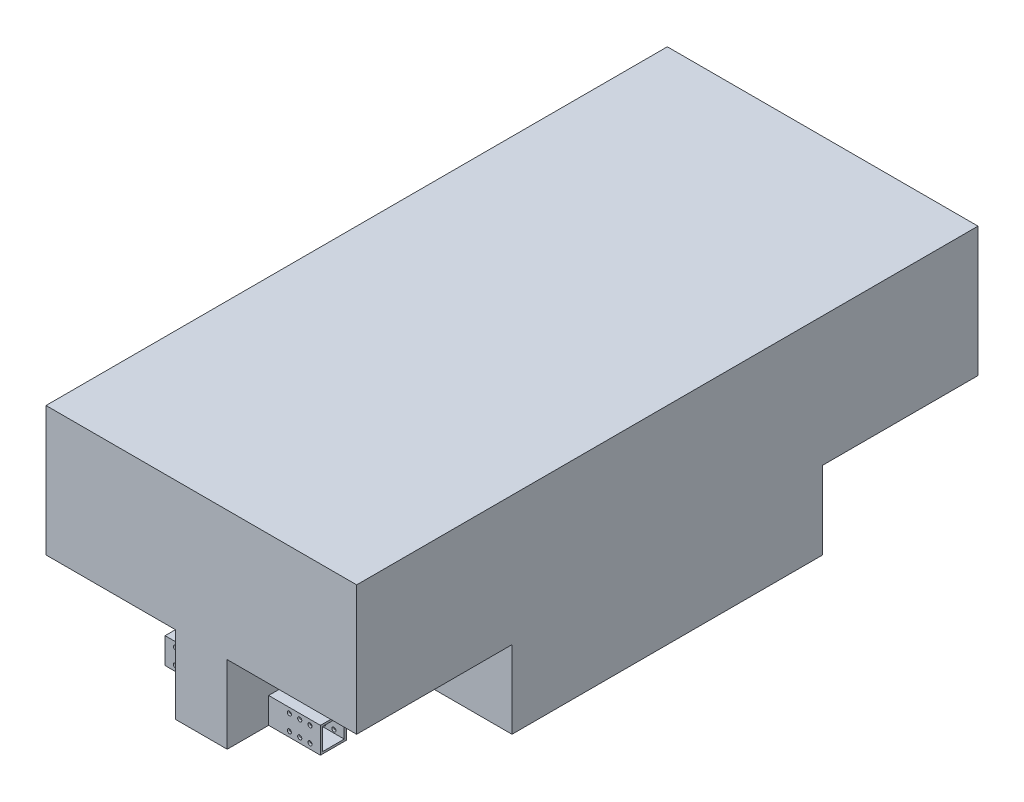
from build123d import *

# Parameters (mm, degrees)
BOSS_EXTRUDE1_DEPTH       = 150
BOSS_EXTRUDE1_DEPTH_BACK  = 150
SKETCH2_W                 = 600
SKETCH2_H                 = 200
SKETCH3_W                 = 150
SKETCH3_H                 = 75
CUT_EXTRUDE1_DEPTH        = 125
SKETCH4_W                 = 25
SKETCH4_H                 = 25
SKETCH4_W_2               = 21
SKETCH4_H_2               = 21
BOSS_EXTRUDE2_DEPTH       = 50
SKETCH5_R                 = 2
CUT_EXTRUDE2_DEPTH        = 25
MIRROR3_COPY_1_SKETCH_W   = 25
MIRROR3_COPY_1_SKETCH_H   = 25
MIRROR3_COPY_1_SKETCH_W_2 = 21
MIRROR3_COPY_1_SKETCH_H_2 = 21
MIRROR3_COPY_1_DEPTH      = 50
MIRROR3_COPY_2_SKETCH_R   = 2
MIRROR3_COPY_2_DEPTH      = 25
MIRROR3_COPY_3_SKETCH_W   = 25
MIRROR3_COPY_3_SKETCH_H   = 25
MIRROR3_COPY_3_SKETCH_W_2 = 21
MIRROR3_COPY_3_SKETCH_H_2 = 21
MIRROR3_COPY_3_DEPTH      = 50
MIRROR3_COPY_4_SKETCH_R   = 2
MIRROR3_COPY_4_DEPTH      = 25


with BuildPart() as part:
    # Sketch2 → Boss-Extrude1 (new, two sides: drawn at the far end of the back side and taken through both)
    with BuildSketch(Plane(origin=(0, 0, 0), x_dir=(0, 0, -1), z_dir=(1, 0, 0)).offset(-BOSS_EXTRUDE1_DEPTH_BACK)):
        Rectangle(SKETCH2_W, SKETCH2_H)
    extrude(amount=BOSS_EXTRUDE1_DEPTH + BOSS_EXTRUDE1_DEPTH_BACK)

    # Sketch3 → Cut-Extrude1 (cut)
    with BuildSketch(Plane(origin=(150, 0, 0), x_dir=(0, 0, -1), z_dir=(1, 0, 0))):
        with Locations((-225, -62.5)):
            Rectangle(SKETCH3_W, SKETCH3_H)
        with Locations((225, -62.5)):
            Rectangle(SKETCH3_W, SKETCH3_H)
    cut_extrude1 = extrude(amount=-CUT_EXTRUDE1_DEPTH, mode=Mode.SUBTRACT)

    # Mirror1: Cut-Extrude1 across plane
    add(cut_extrude1.mirror(Plane(origin=(0, 0, 0), x_dir=(0, 0, 1), z_dir=(1, 0, 0))), mode=Mode.SUBTRACT)

    # Sketch4 → Boss-Extrude2 (add)
    with BuildSketch(Plane(origin=(25, 0, 0), x_dir=(0, 0, -1), z_dir=(1, 0, 0))):
        with Locations((-247.5, -87.5)):
            Rectangle(SKETCH4_W, SKETCH4_H)
        with Locations((-247.5, -87.5)):
            Rectangle(SKETCH4_W_2, SKETCH4_H_2, mode=Mode.SUBTRACT)
    boss_extrude2 = extrude(amount=BOSS_EXTRUDE2_DEPTH)

    # Sketch5 → Cut-Extrude2 (cut)
    with BuildSketch(Plane.XY.offset(260)):
        with Locations((65, -80)):
            Circle(SKETCH5_R)
        with Locations((55, -80)):
            Circle(SKETCH5_R)
        with Locations((45, -80)):
            Circle(SKETCH5_R)
        with Locations((65, -95)):
            Circle(SKETCH5_R)
        with Locations((55, -95)):
            Circle(SKETCH5_R)
        with Locations((45, -95)):
            Circle(SKETCH5_R)
    cut_extrude2 = extrude(amount=-CUT_EXTRUDE2_DEPTH, mode=Mode.SUBTRACT)

    # Mirror2: Boss-Extrude2, Cut-Extrude2 across plane
    add(boss_extrude2.mirror(Plane(origin=(0, 0, 0), x_dir=(0, 0, 1), z_dir=(1, 0, 0))))
    add(cut_extrude2.mirror(Plane(origin=(0, 0, 0), x_dir=(0, 0, 1), z_dir=(1, 0, 0))), mode=Mode.SUBTRACT)

    # Mirror3 copy 1 sketch → Mirror3 copy 1 (add)
    with BuildSketch(Plane.ZY.offset(25)):
        with Locations((-247.5, -87.5)):
            Rectangle(MIRROR3_COPY_1_SKETCH_W, MIRROR3_COPY_1_SKETCH_H)
        with Locations((-247.5, -87.5)):
            Rectangle(MIRROR3_COPY_1_SKETCH_W_2, MIRROR3_COPY_1_SKETCH_H_2, mode=Mode.SUBTRACT)
    extrude(amount=MIRROR3_COPY_1_DEPTH)

    # Mirror3 copy 2 sketch → Mirror3 copy 2 (cut)
    with BuildSketch(Plane(origin=(0, 0, -260), x_dir=(-1, 0, 0), z_dir=(0, 0, -1))):
        with Locations((65, -80)):
            Circle(MIRROR3_COPY_2_SKETCH_R)
        with Locations((55, -80)):
            Circle(MIRROR3_COPY_2_SKETCH_R)
        with Locations((45, -80)):
            Circle(MIRROR3_COPY_2_SKETCH_R)
        with Locations((65, -95)):
            Circle(MIRROR3_COPY_2_SKETCH_R)
        with Locations((55, -95)):
            Circle(MIRROR3_COPY_2_SKETCH_R)
        with Locations((45, -95)):
            Circle(MIRROR3_COPY_2_SKETCH_R)
    extrude(amount=-MIRROR3_COPY_2_DEPTH, mode=Mode.SUBTRACT)

    # Mirror3 copy 3 sketch → Mirror3 copy 3 (add)
    with BuildSketch(Plane(origin=(25, 0, 0), x_dir=(0, 0, 1), z_dir=(1, 0, 0))):
        with Locations((-247.5, 87.5)):
            Rectangle(MIRROR3_COPY_3_SKETCH_W, MIRROR3_COPY_3_SKETCH_H)
        with Locations((-247.5, 87.5)):
            Rectangle(MIRROR3_COPY_3_SKETCH_W_2, MIRROR3_COPY_3_SKETCH_H_2, mode=Mode.SUBTRACT)
    extrude(amount=MIRROR3_COPY_3_DEPTH)

    # Mirror3 copy 4 sketch → Mirror3 copy 4 (cut)
    with BuildSketch(Plane(origin=(0, 0, -260), x_dir=(1, 0, 0), z_dir=(0, 0, -1))):
        with Locations((65, 80)):
            Circle(MIRROR3_COPY_4_SKETCH_R)
        with Locations((55, 80)):
            Circle(MIRROR3_COPY_4_SKETCH_R)
        with Locations((45, 80)):
            Circle(MIRROR3_COPY_4_SKETCH_R)
        with Locations((65, 95)):
            Circle(MIRROR3_COPY_4_SKETCH_R)
        with Locations((55, 95)):
            Circle(MIRROR3_COPY_4_SKETCH_R)
        with Locations((45, 95)):
            Circle(MIRROR3_COPY_4_SKETCH_R)
    extrude(amount=-MIRROR3_COPY_4_DEPTH, mode=Mode.SUBTRACT)


solid = part.part
